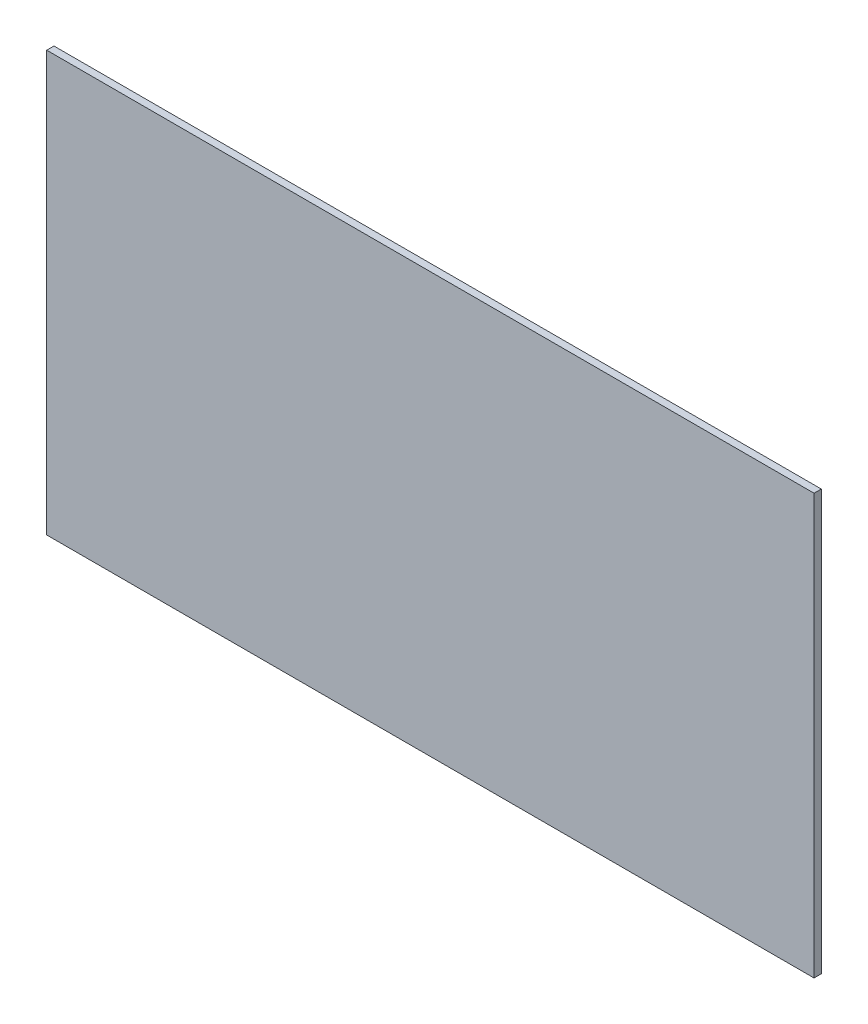
from build123d import *

# Parameters (mm, degrees)
SKETCH1_W           = 13.462
SKETCH1_H           = 7.366
BOSS_EXTRUDE1_DEPTH = 0.127
LEGEND_START        = -0.0254
LEGEND_TEXT_DEPTH   = 0.0254


# Read off the part's stored shape, not the designer's step: Legend Text
with BuildPart() as part:
    # Sketch1 → Boss-Extrude1 (new body)
    with BuildSketch(Plane.XY):
        with Locations((71.800681464, 114.580869701)):
            Rectangle(SKETCH1_W, SKETCH1_H)
    extrude(amount=BOSS_EXTRUDE1_DEPTH)

    # Legend Text outline → Legend Text (cut)
    # profile 1 of 4: a face of its own
    with BuildSketch(Plane(origin=(0, 0, 0), x_dir=(-1, 0, 0), z_dir=(0, 0, -1)).offset(LEGEND_START)):
        with BuildLine():
            add(Edge.make_bspline(
                [(-68.784550455, 113.401817513), (-68.763814965, 113.403450101), (-68.722975936, 113.406665522), (-68.663517243, 113.418947681), (-68.606934998, 113.435696163), (-68.553293855, 113.457843965), (-68.503002917, 113.48558894), (-68.455816965, 113.518656873), (-68.411625359, 113.556711828), (-68.370481107, 113.599506892), (-68.333310124, 113.64671699), (-68.301081384, 113.697939549), (-68.273322518, 113.752095701), (-68.250640785, 113.809801106), (-68.232569352, 113.870597524), (-68.219884801, 113.934686716), (-68.210955411, 114.001815856), (-68.209549437, 114.047751454), (-68.20882861, 114.071302106)],
                knots=[0, 0, 0, 0, 0.063599333, 0.125260361, 0.185380231, 0.243983491, 0.302487647, 0.360795932, 0.420007138, 0.480689722, 0.54220538, 0.603551003, 0.665616721, 0.728172033, 0.793035682, 0.859440249, 0.927936636, 1, 1, 1, 1], degree=3))
            add(Edge.make_bspline(
                [(-68.20882861, 114.071302106), (-68.209982381, 114.099943925), (-68.212271058, 114.156759238), (-68.225152599, 114.240554964), (-68.247729196, 114.321311782), (-68.277195585, 114.398543028), (-68.313716277, 114.470750694), (-68.356291135, 114.536026357), (-68.405954057, 114.592846084), (-68.443611676, 114.624575127), (-68.462284831, 114.640308499)],
                knots=[0, 0, 0, 0, 0.133571488, 0.264958941, 0.394137348, 0.523815182, 0.649747928, 0.770668013, 0.886281932, 1, 1, 1, 1], degree=3))
            add(Edge.make_bspline(
                [(-68.462284831, 114.640308499), (-68.478615254, 114.651409028), (-68.511523789, 114.673778454), (-68.567412516, 114.701653076), (-68.633538803, 114.725962581), (-68.682117713, 114.739146169), (-68.708967166, 114.746432707)],
                knots=[0, 0, 0, 0, 0.219024644, 0.441371329, 0.691247208, 1, 1, 1, 1], degree=3))
            Line((-68.708967166, 114.746432707), (-69.052546715, 114.83320272))
            add(Edge.make_bspline(
                [(-69.052546715, 114.83320272), (-69.069150991, 114.837272677), (-69.100521331, 114.844962018), (-69.142485244, 114.863475464), (-69.178024771, 114.884229678), (-69.1960652, 114.902588756), (-69.204589798, 114.911263924)],
                knots=[0, 0, 0, 0, 0.294796546, 0.556957043, 0.79065006, 1, 1, 1, 1], degree=3))
            add(Edge.make_bspline(
                [(-69.204589798, 114.911263924), (-69.214116811, 114.921748162), (-69.233521845, 114.943102911), (-69.257165162, 114.980053573), (-69.278517377, 115.020179829), (-69.296305469, 115.063675648), (-69.310159181, 115.110079818), (-69.321088516, 115.157722648), (-69.327371971, 115.206890766), (-69.328304898, 115.239968461), (-69.328777701, 115.256732091)],
                knots=[0, 0, 0, 0, 0.112997851, 0.230158927, 0.349185819, 0.475927561, 0.60480001, 0.735733993, 0.866071147, 1, 1, 1, 1], degree=3))
            add(Edge.make_bspline(
                [(-69.328777701, 115.256732091), (-69.328432982, 115.274076651), (-69.327755269, 115.308175883), (-69.319709963, 115.358327246), (-69.308779866, 115.406991053), (-69.29292426, 115.453644681), (-69.273360863, 115.497556999), (-69.250107059, 115.537847949), (-69.22367388, 115.574469246), (-69.202979376, 115.59566145), (-69.192735498, 115.606151691)],
                knots=[0, 0, 0, 0, 0.135094081, 0.26559362, 0.395124796, 0.523630082, 0.64905025, 0.769328651, 0.885816585, 1, 1, 1, 1], degree=3))
            add(Edge.make_bspline(
                [(-69.192735498, 115.606151691), (-69.179638832, 115.617191088), (-69.152892407, 115.639736092), (-69.102368665, 115.661427872), (-69.044381795, 115.674399004), (-69.002958593, 115.675912549), (-68.981051572, 115.676713)],
                knots=[0, 0, 0, 0, 0.223770634, 0.456991469, 0.712825212, 1, 1, 1, 1], degree=3))
            Line((-68.981051572, 115.676713), (-68.788550399, 115.677190391))
            add(Edge.make_bspline(
                [(-68.788550399, 115.677190391), (-68.77745857, 115.677578824), (-68.755810954, 115.678336918), (-68.723836728, 115.676572556), (-68.6936369, 115.669265171), (-68.664381283, 115.659318341), (-68.636772083, 115.644617722), (-68.611251349, 115.625432695), (-68.586524289, 115.603255416), (-68.555794325, 115.567756494), (-68.523752295, 115.515378313), (-68.49543254, 115.443923142), (-68.479989521, 115.362954067), (-68.47874074, 115.306093603), (-68.478090564, 115.276489258)],
                knots=[0, 0, 0, 0, 0.057893916, 0.112989943, 0.166318385, 0.219393398, 0.27382999, 0.328592895, 0.385562358, 0.446769483, 0.572846214, 0.703690997, 0.845727005, 1, 1, 1, 1], degree=3))
            add(Edge.make_bspline(
                [(-68.478090564, 115.276489258), (-68.477935964, 115.260849964), (-68.477645493, 115.231465895), (-68.471099417, 115.190258956), (-68.459160776, 115.155463829), (-68.443517789, 115.126071269), (-68.421916693, 115.103245609), (-68.395245053, 115.08703394), (-68.363671823, 115.078075694), (-68.341351418, 115.07677711), (-68.329629571, 115.076095141)],
                knots=[0, 0, 0, 0, 0.164761429, 0.30956393, 0.437544781, 0.551227783, 0.657873367, 0.764703299, 0.876430919, 1, 1, 1, 1], degree=3))
            add(Edge.make_bspline(
                [(-68.329629571, 115.076095141), (-68.316364397, 115.077251008), (-68.291211885, 115.079442682), (-68.256055533, 115.091078556), (-68.225910853, 115.109427703), (-68.201183516, 115.134908915), (-68.182233457, 115.167096001), (-68.169122296, 115.205719286), (-68.159814157, 115.250660487), (-68.158645061, 115.283020278), (-68.158024468, 115.300197857)],
                knots=[0, 0, 0, 0, 0.125243407, 0.237477963, 0.34582937, 0.455005964, 0.568828628, 0.695123677, 0.838162205, 1, 1, 1, 1], degree=3))
            add(Edge.make_bspline(
                [(-68.158024468, 115.300197857), (-68.158965832, 115.325623335), (-68.160798578, 115.375124324), (-68.169775705, 115.447511645), (-68.184873169, 115.515839896), (-68.203236905, 115.581126875), (-68.229335172, 115.64156938), (-68.259165149, 115.698762114), (-68.294898863, 115.751823513), (-68.335557227, 115.800980561), (-68.380343697, 115.845281769), (-68.428842795, 115.884263279), (-68.480767202, 115.916970139), (-68.536101498, 115.943704716), (-68.594580247, 115.964686361), (-68.656264136, 115.97971364), (-68.721247486, 115.989813699), (-68.765753218, 115.991060007), (-68.788560322, 115.991698682)],
                knots=[0, 0, 0, 0, 0.072749061, 0.14163551, 0.208239069, 0.272775527, 0.335243706, 0.396150844, 0.457048471, 0.517822323, 0.57832872, 0.636908998, 0.695437342, 0.753443789, 0.812342086, 0.872774246, 0.934802758, 1, 1, 1, 1], degree=3))
            Line((-68.788560322, 115.991698682), (-68.992547553, 115.988311739))
            add(Edge.make_bspline(
                [(-68.992547553, 115.988311739), (-69.016411943, 115.987035399), (-69.063114501, 115.984537605), (-69.131360135, 115.973788085), (-69.195899348, 115.9566226), (-69.257428527, 115.934490656), (-69.314421673, 115.904433932), (-69.368679163, 115.870045418), (-69.419127317, 115.82920685), (-69.465255421, 115.782084413), (-69.507319232, 115.730583543), (-69.544590471, 115.674816972), (-69.575265466, 115.614701988), (-69.60171163, 115.551066926), (-69.621882777, 115.483112274), (-69.636280166, 115.411099968), (-69.646256174, 115.335274545), (-69.647968652, 115.283295478), (-69.648843797, 115.256732091)],
                knots=[0, 0, 0, 0, 0.065201432, 0.127599052, 0.188140811, 0.247289808, 0.305632859, 0.363615379, 0.422408788, 0.482330892, 0.54329163, 0.60368726, 0.665018977, 0.727202757, 0.791546249, 0.858124041, 0.927495697, 1, 1, 1, 1], degree=3))
            add(Edge.make_bspline(
                [(-69.648843797, 115.256732091), (-69.648259824, 115.233564478), (-69.647112692, 115.188055001), (-69.639308465, 115.12116547), (-69.628528729, 115.056896843), (-69.61227737, 114.995530361), (-69.592883045, 114.936624053), (-69.568173202, 114.880606833), (-69.540331521, 114.826824957), (-69.507377305, 114.776524814), (-69.470694385, 114.729918814), (-69.431119258, 114.686395283), (-69.387430526, 114.647771074), (-69.341077854, 114.612127094), (-69.290561063, 114.58200804), (-69.237233565, 114.55524793), (-69.180607091, 114.532465855), (-69.141098752, 114.520874915), (-69.121045208, 114.514991615)],
                knots=[0, 0, 0, 0, 0.070616639, 0.138716328, 0.205110655, 0.269112602, 0.332059551, 0.393976046, 0.455559475, 0.516498315, 0.576973694, 0.636245435, 0.695556026, 0.754527205, 0.814244199, 0.874531558, 0.936315042, 1, 1, 1, 1], degree=3))
            Line((-69.121045208, 114.514991615), (-68.776550567, 114.428873743))
            add(Edge.make_bspline(
                [(-68.776550567, 114.428873743), (-68.75758613, 114.423685106), (-68.722018471, 114.413953857), (-68.674893004, 114.392231534), (-68.635557876, 114.367569777), (-68.617587027, 114.3450498), (-68.609052353, 114.334354665)],
                knots=[0, 0, 0, 0, 0.299891668, 0.56244457, 0.792197206, 1, 1, 1, 1], degree=3))
            add(Edge.make_bspline(
                [(-68.609052353, 114.334354665), (-68.596963604, 114.315688976), (-68.572698289, 114.278222006), (-68.547063204, 114.215112468), (-68.532540307, 114.146658948), (-68.530127853, 114.099406864), (-68.528894706, 114.07525354)],
                knots=[0, 0, 0, 0, 0.241778697, 0.485313731, 0.736913526, 1, 1, 1, 1], degree=3))
            add(Edge.make_bspline(
                [(-68.528894706, 114.07525354), (-68.529638875, 114.059058748), (-68.531088077, 114.02752083), (-68.536485967, 113.981554381), (-68.546042927, 113.938637829), (-68.559286326, 113.898921516), (-68.574772949, 113.861652729), (-68.594976299, 113.828007788), (-68.617165671, 113.796196778), (-68.635470347, 113.778260541), (-68.644615252, 113.769299706)],
                knots=[0, 0, 0, 0, 0.144669834, 0.281731651, 0.412517926, 0.536256951, 0.655113272, 0.771766142, 0.885975748, 1, 1, 1, 1], degree=3))
            add(Edge.make_bspline(
                [(-68.644615252, 113.769299706), (-68.654558677, 113.762318294), (-68.67641214, 113.746974685), (-68.715573869, 113.731923541), (-68.757583928, 113.719053639), (-68.786781195, 113.715639737), (-68.800979112, 113.71397964)],
                knots=[0, 0, 0, 0, 0.216441272, 0.47569036, 0.745041044, 1, 1, 1, 1], degree=3))
            Line((-68.800979112, 113.71397964), (-68.960547999, 113.710502841))
            Line((-68.960547999, 113.710502841), (-68.976547776, 113.710502841))
            add(Edge.make_bspline(
                [(-68.976547776, 113.710502841), (-68.995664634, 113.711214151), (-69.032044292, 113.712567782), (-69.083125757, 113.727558813), (-69.128249552, 113.750116325), (-69.167154718, 113.782858882), (-69.199744266, 113.825755977), (-69.227866299, 113.878365951), (-69.251359889, 113.941711602), (-69.262840163, 113.987995881), (-69.268941711, 114.012595098)],
                knots=[0, 0, 0, 0, 0.123786576, 0.23556764, 0.342676436, 0.449373233, 0.562541452, 0.690484287, 0.835498271, 1, 1, 1, 1], degree=3))
            add(Edge.make_bspline(
                [(-69.268941711, 114.012595098), (-69.270989189, 114.020692185), (-69.274659114, 114.035205513), (-69.279811992, 114.054377555), (-69.283499676, 114.068569282), (-69.28755452, 114.079992573), (-69.289130687, 114.089948032), (-69.291630751, 114.096350945), (-69.292650311, 114.098962139)],
                knots=[0, 0, 0, 0, 0.279617859, 0.501190759, 0.664744974, 0.770350089, 0.906345655, 1, 1, 1, 1], degree=3))
            add(Edge.make_bspline(
                [(-69.292650311, 114.098962139), (-69.299945582, 114.109858704), (-69.3142629, 114.131243731), (-69.346879061, 114.154260586), (-69.386544417, 114.167171567), (-69.415230847, 114.168710451), (-69.430385985, 114.169523448)],
                knots=[0, 0, 0, 0, 0.240289466, 0.471579558, 0.720833701, 1, 1, 1, 1], degree=3))
            add(Edge.make_bspline(
                [(-69.430385985, 114.169523448), (-69.442290643, 114.168381254), (-69.46493287, 114.166208843), (-69.496605959, 114.157446069), (-69.523262408, 114.142753731), (-69.545875812, 114.124144704), (-69.563123726, 114.099850773), (-69.576326876, 114.071245733), (-69.58393987, 114.037424531), (-69.585411434, 114.013384076), (-69.586185355, 114.000740798)],
                knots=[0, 0, 0, 0, 0.138666773, 0.263739154, 0.37805668, 0.489608986, 0.600539826, 0.720713111, 0.853118334, 1, 1, 1, 1], degree=3))
            add(Edge.make_bspline(
                [(-69.586185355, 114.000740798), (-69.584897436, 113.979208731), (-69.582121476, 113.932798867), (-69.564723605, 113.861518704), (-69.539599211, 113.786860398), (-69.516155164, 113.738409492), (-69.504334237, 113.71397964)],
                knots=[0, 0, 0, 0, 0.214938982, 0.463275972, 0.729373707, 1, 1, 1, 1], degree=3))
            add(Edge.make_bspline(
                [(-69.504334237, 113.71397964), (-69.490133331, 113.689262834), (-69.462179855, 113.640609551), (-69.40939261, 113.576245226), (-69.350962582, 113.51953954), (-69.286386269, 113.472509633), (-69.218324777, 113.435381706), (-69.149088961, 113.408173815), (-69.078838765, 113.392755111), (-69.03192573, 113.392019558), (-69.008711605, 113.391655582)],
                knots=[0, 0, 0, 0, 0.137457703, 0.270575754, 0.400396349, 0.529806033, 0.655052246, 0.773856294, 0.888096596, 1, 1, 1, 1], degree=3))
            Line((-69.008711605, 113.391655582), (-68.988547609, 113.391656133))
            Line((-68.988547609, 113.391656133), (-68.784550455, 113.401817513))
        make_face()
    # profile 2 of 4: a face of its own
    with BuildSketch(Plane(origin=(0, 0, 0), x_dir=(-1, 0, 0), z_dir=(0, 0, -1)).offset(LEGEND_START)):
        with BuildLine():
            Line((-70.949429837, 113.712287271), (-71.335710004, 113.712287271))
            add(Edge.make_bspline(
                [(-71.335710004, 113.712287271), (-71.351301343, 113.711721414), (-71.380660892, 113.710655867), (-71.421533838, 113.70353667), (-71.456430823, 113.69173176), (-71.485506538, 113.674983905), (-71.507503982, 113.651961796), (-71.523922598, 113.624939747), (-71.532860429, 113.592581546), (-71.534133343, 113.569710087), (-71.534806453, 113.55761578)],
                knots=[0, 0, 0, 0, 0.162897657, 0.306747336, 0.431731416, 0.546374995, 0.653433857, 0.760997037, 0.873616484, 1, 1, 1, 1], degree=3))
            add(Edge.make_bspline(
                [(-71.534806453, 113.55761578), (-71.534161724, 113.544571158), (-71.532947938, 113.520013015), (-71.523769283, 113.48552727), (-71.508552877, 113.456169742), (-71.486859134, 113.432256815), (-71.459388949, 113.413718232), (-71.425987122, 113.401033713), (-71.386899871, 113.393096879), (-71.35891668, 113.392156544), (-71.344008675, 113.391655582)],
                knots=[0, 0, 0, 0, 0.13549594, 0.255088173, 0.36798027, 0.476021954, 0.587257675, 0.709320559, 0.84514094, 1, 1, 1, 1], degree=3))
            Line((-71.344008675, 113.391655582), (-70.254223993, 113.391656133))
            add(Edge.make_bspline(
                [(-70.254223993, 113.391656133), (-70.237548869, 113.391719922), (-70.206343809, 113.391839292), (-70.162779759, 113.399435442), (-70.125751092, 113.410984879), (-70.094468665, 113.427015302), (-70.071378305, 113.450114088), (-70.054122259, 113.477301507), (-70.045300914, 113.510243771), (-70.044441193, 113.533485948), (-70.043987125, 113.54576148)],
                knots=[0, 0, 0, 0, 0.167323449, 0.313121427, 0.442287347, 0.556528349, 0.662166905, 0.766596956, 0.876726412, 1, 1, 1, 1], degree=3))
            add(Edge.make_bspline(
                [(-70.043987125, 113.54576148), (-70.044628317, 113.558809586), (-70.045835441, 113.583374288), (-70.055058758, 113.617816053), (-70.070179634, 113.647439579), (-70.092739977, 113.671061963), (-70.120355597, 113.69033596), (-70.15471871, 113.702944876), (-70.194721545, 113.710834056), (-70.2234515, 113.711781899), (-70.238736337, 113.712286168)],
                knots=[0, 0, 0, 0, 0.13367795, 0.251665576, 0.363042966, 0.47093762, 0.583363643, 0.705585, 0.843366093, 1, 1, 1, 1], degree=3))
            Line((-70.238736337, 113.712286168), (-70.6287987, 113.712287271))
            Line((-70.6287987, 113.712287271), (-70.6287987, 115.770984011))
            add(Edge.make_bspline(
                [(-70.6287987, 115.770984011), (-70.628681375, 115.783217472), (-70.628466512, 115.805621389), (-70.62978431, 115.83609425), (-70.631084206, 115.860660357), (-70.634734841, 115.884790035), (-70.641586331, 115.910508899), (-70.653820999, 115.92632947), (-70.659846227, 115.934120654)],
                knots=[0, 0, 0, 0, 0.216060692, 0.395685733, 0.538969935, 0.649917571, 0.82759431, 1, 1, 1, 1], degree=3))
            add(Edge.make_bspline(
                [(-70.659846227, 115.934120654), (-70.668373722, 115.942242115), (-70.685347214, 115.95840742), (-70.716860105, 115.975630636), (-70.752733052, 115.985919109), (-70.778129427, 115.987491702), (-70.791372506, 115.988311739)],
                knots=[0, 0, 0, 0, 0.240761183, 0.479221355, 0.728437127, 1, 1, 1, 1], degree=3))
            add(Edge.make_bspline(
                [(-70.791372506, 115.988311739), (-70.804213525, 115.988500506), (-70.828316862, 115.988854832), (-70.862194735, 115.980795315), (-70.890970706, 115.966033886), (-70.913665281, 115.94325456), (-70.931536693, 115.914393654), (-70.942808089, 115.878562184), (-70.949779522, 115.836552078), (-70.949552105, 115.806391159), (-70.949429837, 115.790175584)],
                knots=[0, 0, 0, 0, 0.1303468, 0.244668505, 0.350952396, 0.455284039, 0.568004952, 0.693428508, 0.835176339, 1, 1, 1, 1], degree=3))
            Line((-70.949429837, 115.790175584), (-70.949429837, 113.712287271))
        make_face()
    # profile 3 of 4: a face of its own
    with BuildSketch(Plane(origin=(0, 0, 0), x_dir=(-1, 0, 0), z_dir=(0, 0, -1)).offset(LEGEND_START)):
        with BuildLine():
            Line((-73.223376606, 114.577050837), (-73.227278426, 114.577050837))
            add(Edge.make_bspline(
                [(-73.227278426, 114.577050837), (-73.244951129, 114.558980541), (-73.279531537, 114.523622158), (-73.323886729, 114.465126411), (-73.36130373, 114.404294976), (-73.391370991, 114.34018118), (-73.415532085, 114.27342348), (-73.431408056, 114.203250886), (-73.441667729, 114.130317383), (-73.442033456, 114.080746592), (-73.442219748, 114.055496373)],
                knots=[0, 0, 0, 0, 0.130448083, 0.255249458, 0.378266884, 0.49869614, 0.62043218, 0.744203675, 0.86970325, 1, 1, 1, 1], degree=3))
            add(Edge.make_bspline(
                [(-73.442219748, 114.055496373), (-73.441210297, 114.032144738), (-73.439225985, 113.986241639), (-73.431043284, 113.91890935), (-73.416568598, 113.854846866), (-73.398096141, 113.793814969), (-73.374986376, 113.735858386), (-73.346648779, 113.681375353), (-73.313005857, 113.630260879), (-73.274916263, 113.582557315), (-73.232793556, 113.539206754), (-73.187518834, 113.501270329), (-73.139525304, 113.468680042), (-73.088812462, 113.441312996), (-73.034574225, 113.420682591), (-72.978017925, 113.404481331), (-72.918288037, 113.395067359), (-72.877570537, 113.392806487), (-72.856843132, 113.391655582)],
                knots=[0, 0, 0, 0, 0.071163137, 0.139887785, 0.206200628, 0.270907243, 0.333896404, 0.395916463, 0.457578168, 0.51994926, 0.581539044, 0.641330138, 0.699495776, 0.757940144, 0.816356419, 0.875858538, 0.936805293, 1, 1, 1, 1], degree=3))
            Line((-72.856843132, 113.391655582), (-72.181590702, 113.391656133))
            add(Edge.make_bspline(
                [(-72.181590702, 113.391656133), (-72.165209126, 113.392291554), (-72.134570387, 113.393479992), (-72.092624995, 113.402353248), (-72.05793387, 113.41612934), (-72.03099502, 113.436756356), (-72.011414217, 113.464502671), (-71.99898279, 113.499544216), (-71.990963464, 113.54163329), (-71.990931754, 113.572248437), (-71.990914752, 113.588662755)],
                knots=[0, 0, 0, 0, 0.153417679, 0.286939669, 0.399947666, 0.500488246, 0.600330349, 0.713654415, 0.846475742, 1, 1, 1, 1], degree=3))
            Line((-71.990914752, 113.588662755), (-71.990401529, 115.783560462))
            add(Edge.make_bspline(
                [(-71.990401529, 115.783560462), (-71.989857771, 115.801211483), (-71.988856976, 115.83369841), (-71.99491571, 115.878696872), (-72.006669465, 115.915688129), (-72.026148727, 115.944999543), (-72.054220749, 115.965603871), (-72.089768515, 115.979368779), (-72.133161739, 115.987695628), (-72.164736052, 115.988096307), (-72.181712531, 115.988311739)],
                knots=[0, 0, 0, 0, 0.158927213, 0.292507531, 0.407271171, 0.506049917, 0.604068815, 0.715862285, 0.847228411, 1, 1, 1, 1], degree=3))
            Line((-72.181712531, 115.988311739), (-72.759060042, 115.988311739))
            add(Edge.make_bspline(
                [(-72.759060042, 115.988311739), (-72.779805933, 115.987973017), (-72.820004771, 115.987316684), (-72.878081311, 115.98268693), (-72.931436923, 115.972849812), (-72.980950393, 115.959789315), (-73.028235138, 115.942503125), (-73.07452774, 115.920399039), (-73.120582836, 115.893120139), (-73.149982787, 115.871711975), (-73.165054928, 115.860736893)],
                knots=[0, 0, 0, 0, 0.143289664, 0.277649108, 0.401784546, 0.51747006, 0.630937378, 0.748935385, 0.871289538, 1, 1, 1, 1], degree=3))
            add(Edge.make_bspline(
                [(-73.165054928, 115.860736893), (-73.18573137, 115.842070409), (-73.227487642, 115.804373266), (-73.281102513, 115.736982428), (-73.328574902, 115.661919673), (-73.368514851, 115.57869588), (-73.400459671, 115.488982355), (-73.424415655, 115.393787252), (-73.438457313, 115.293268318), (-73.440948514, 115.224598968), (-73.442219748, 115.189557725)],
                knots=[0, 0, 0, 0, 0.111467294, 0.22510926, 0.34372318, 0.466818214, 0.594181077, 0.724757774, 0.859546802, 1, 1, 1, 1], degree=3))
            add(Edge.make_bspline(
                [(-73.442219748, 115.189557725), (-73.441840109, 115.16092282), (-73.441095733, 115.104776933), (-73.430461106, 115.022619522), (-73.413838988, 114.944255586), (-73.389253982, 114.869304445), (-73.356283831, 114.796517506), (-73.315242909, 114.724169607), (-73.26625637, 114.650931193), (-73.227768865, 114.604417107), (-73.207956203, 114.580472509)],
                knots=[0, 0, 0, 0, 0.128444356, 0.251847255, 0.371120416, 0.487567242, 0.605135768, 0.729169992, 0.860581679, 1, 1, 1, 1], degree=3))
            Line((-73.207956203, 114.580472509), (-73.223376606, 114.577050837))
        make_face()
        with BuildLine():
            Line((-72.310350758, 113.712287271), (-72.8292928, 113.712287271))
            add(Edge.make_bspline(
                [(-72.8292928, 113.712287271), (-72.841108669, 113.712415305), (-72.863098147, 113.712653579), (-72.894053544, 113.713862045), (-72.920418007, 113.718021148), (-72.950290477, 113.72438696), (-72.984178189, 113.739619173), (-73.005596245, 113.759229991), (-73.016593934, 113.769299706)],
                knots=[0, 0, 0, 0, 0.175434205, 0.326485192, 0.459200983, 0.570988135, 0.779712054, 1, 1, 1, 1], degree=3))
            add(Edge.make_bspline(
                [(-73.016593934, 113.769299706), (-73.032520335, 113.788276543), (-73.064515426, 113.826399762), (-73.097270634, 113.895656498), (-73.117130661, 113.972930017), (-73.120440426, 114.0273349), (-73.122153652, 114.055496373)],
                knots=[0, 0, 0, 0, 0.237392928, 0.476906795, 0.729232475, 1, 1, 1, 1], degree=3))
            add(Edge.make_bspline(
                [(-73.122153652, 114.055496373), (-73.120892298, 114.083474907), (-73.118464805, 114.137319985), (-73.098835443, 114.213500433), (-73.06725825, 114.281825702), (-73.036095874, 114.31950403), (-73.020545368, 114.338306098)],
                knots=[0, 0, 0, 0, 0.272613178, 0.524647865, 0.76279194, 1, 1, 1, 1], degree=3))
            add(Edge.make_bspline(
                [(-73.020545368, 114.338306098), (-73.009604565, 114.349335015), (-72.988476281, 114.37063346), (-72.954405038, 114.387822753), (-72.924494158, 114.396054431), (-72.897991769, 114.400288539), (-72.867259262, 114.403264543), (-72.845373857, 114.403237127), (-72.833699023, 114.403222502)],
                knots=[0, 0, 0, 0, 0.226233756, 0.436890346, 0.548504896, 0.679825828, 0.829202146, 1, 1, 1, 1], degree=3))
            Line((-72.833699023, 114.403222502), (-72.310350758, 114.403222502))
            Line((-72.310350758, 114.403222502), (-72.310350758, 113.712287271))
        make_face(mode=Mode.SUBTRACT)
        with BuildLine():
            Line((-72.290841659, 114.72385364), (-72.762961862, 114.72385364))
            add(Edge.make_bspline(
                [(-72.762961862, 114.72385364), (-72.782070501, 114.723987473), (-72.81692479, 114.724231587), (-72.865833608, 114.733357512), (-72.909242084, 114.750994891), (-72.933799843, 114.769519704), (-72.946597116, 114.779173154)],
                knots=[0, 0, 0, 0, 0.291508259, 0.531713047, 0.75597136, 1, 1, 1, 1], degree=3))
            add(Edge.make_bspline(
                [(-72.946597116, 114.779173154), (-72.959537938, 114.790698193), (-72.985775017, 114.814064821), (-73.019577397, 114.85597731), (-73.049537261, 114.903168069), (-73.075625543, 114.955400956), (-73.095283567, 115.01230859), (-73.111004881, 115.071831483), (-73.119937488, 115.133971318), (-73.121410549, 115.176171978), (-73.122153652, 115.197460592)],
                knots=[0, 0, 0, 0, 0.110984547, 0.225017424, 0.343859372, 0.469068413, 0.598464438, 0.729298708, 0.863441586, 1, 1, 1, 1], degree=3))
            add(Edge.make_bspline(
                [(-73.122153652, 115.197460592), (-73.121710152, 115.215545312), (-73.120838973, 115.251069533), (-73.114276019, 115.303104321), (-73.104951148, 115.353018664), (-73.091330965, 115.400632098), (-73.073807696, 115.446005034), (-73.052247819, 115.489085267), (-73.026857022, 115.529881424), (-73.007223474, 115.555133369), (-72.997401259, 115.56776634)],
                knots=[0, 0, 0, 0, 0.136018339, 0.267183868, 0.39406249, 0.517733739, 0.639189461, 0.759476315, 0.879671503, 1, 1, 1, 1], degree=3))
            add(Edge.make_bspline(
                [(-72.997401259, 115.56776634), (-72.989923437, 115.576649046), (-72.975390355, 115.593912511), (-72.950078515, 115.615507558), (-72.923378997, 115.633188551), (-72.894305039, 115.647427039), (-72.861379779, 115.656646302), (-72.824162944, 115.663436599), (-72.781843961, 115.667232501), (-72.751855066, 115.667526257), (-72.736042171, 115.667681153)],
                knots=[0, 0, 0, 0, 0.119313871, 0.231885509, 0.340904025, 0.448294015, 0.563466716, 0.691452478, 0.837305457, 1, 1, 1, 1], degree=3))
            Line((-72.736042171, 115.667681153), (-72.290841659, 115.667681153))
            Line((-72.290841659, 115.667681153), (-72.290841659, 114.72385364))
        make_face(mode=Mode.SUBTRACT)
    # profile 4 of 4: a face of its own
    with BuildSketch(Plane(origin=(0, 0, 0), x_dir=(-1, 0, 0), z_dir=(0, 0, -1)).offset(LEGEND_START)):
        with BuildLine():
            Line((-74.582489944, 114.503018243), (-74.157191579, 113.502854692))
            add(Edge.make_bspline(
                [(-74.157191579, 113.502854692), (-74.153273617, 113.493454442), (-74.145790054, 113.475499351), (-74.129790464, 113.452495431), (-74.113966184, 113.431911896), (-74.094455055, 113.416860223), (-74.074325655, 113.403642736), (-74.051328447, 113.396320023), (-74.027073097, 113.391229107), (-74.010315775, 113.39150999), (-74.001629803, 113.391655582)],
                knots=[0, 0, 0, 0, 0.148007734, 0.282704437, 0.407417976, 0.524407071, 0.640167052, 0.756446138, 0.873756545, 1, 1, 1, 1], degree=3))
            add(Edge.make_bspline(
                [(-74.001629803, 113.391655582), (-73.990493976, 113.392463901), (-73.968883101, 113.394032574), (-73.937761465, 113.401645101), (-73.910262275, 113.41597912), (-73.885396791, 113.433576083), (-73.864883473, 113.455896232), (-73.849238178, 113.481458874), (-73.840066885, 113.510753712), (-73.838285809, 113.531211405), (-73.837363076, 113.541810047)],
                knots=[0, 0, 0, 0, 0.135506683, 0.262972674, 0.385595346, 0.509909445, 0.631183515, 0.751093818, 0.871047653, 1, 1, 1, 1], degree=3))
            add(Edge.make_bspline(
                [(-73.837363076, 113.541810047), (-73.837911968, 113.549927426), (-73.839099154, 113.567484304), (-73.84572225, 113.595613169), (-73.857326964, 113.626936314), (-73.867139964, 113.648747343), (-73.872361485, 113.660353045)],
                knots=[0, 0, 0, 0, 0.195859132, 0.423618867, 0.693306192, 1, 1, 1, 1], degree=3))
            Line((-73.872361485, 113.660353045), (-73.880162369, 113.67611137))
            Line((-73.880162369, 113.67611137), (-74.42251533, 114.951910546))
            Line((-74.42251533, 114.951910546), (-74.42251533, 115.806380981))
            add(Edge.make_bspline(
                [(-74.42251533, 115.806380981), (-74.422922412, 115.820780553), (-74.423693059, 115.848040396), (-74.431204502, 115.886071673), (-74.44227865, 115.919089586), (-74.460578547, 115.945478735), (-74.483832044, 115.965876393), (-74.512316924, 115.980217982), (-74.545936895, 115.988140678), (-74.569840624, 115.988252541), (-74.582490495, 115.988311739)],
                knots=[0, 0, 0, 0, 0.154396486, 0.292288132, 0.415018318, 0.525421887, 0.632807831, 0.743948415, 0.864497304, 1, 1, 1, 1], degree=3))
            add(Edge.make_bspline(
                [(-74.582490495, 115.988311739), (-74.594024756, 115.987993456), (-74.616816808, 115.987364518), (-74.649463671, 115.97893136), (-74.680529401, 115.966681188), (-74.698612563, 115.954077216), (-74.707807379, 115.947668425)],
                knots=[0, 0, 0, 0, 0.257345281, 0.508522159, 0.750096344, 1, 1, 1, 1], degree=3))
            add(Edge.make_bspline(
                [(-74.707807379, 115.947668425), (-74.713989375, 115.941239077), (-74.72735105, 115.927342778), (-74.735174326, 115.902235093), (-74.739400425, 115.87781258), (-74.741289167, 115.853226791), (-74.743297682, 115.823512839), (-74.742978008, 115.801847446), (-74.742805788, 115.790175584)],
                knots=[0, 0, 0, 0, 0.159348626, 0.344413794, 0.461814385, 0.608663581, 0.789174157, 1, 1, 1, 1], degree=3))
            Line((-74.742805788, 115.790175584), (-74.742464558, 114.947972894))
            Line((-74.742464558, 114.947972894), (-75.27311206, 113.687924325))
            Line((-75.27311206, 113.687924325), (-75.280915699, 113.664298414))
            add(Edge.make_bspline(
                [(-75.280915699, 113.664298414), (-75.285299488, 113.654938091), (-75.2932264, 113.638012444), (-75.302442467, 113.614755341), (-75.310098914, 113.597271511), (-75.316370471, 113.580553102), (-75.320739293, 113.561238826), (-75.320439169, 113.545976431), (-75.320279538, 113.537858613)],
                knots=[0, 0, 0, 0, 0.231524356, 0.418650011, 0.560372718, 0.659066661, 0.818663143, 1, 1, 1, 1], degree=3))
            add(Edge.make_bspline(
                [(-75.320279538, 113.537858613), (-75.319582663, 113.527441632), (-75.318224542, 113.507140263), (-75.308965407, 113.478358082), (-75.293944548, 113.453045466), (-75.273883726, 113.43141058), (-75.249572013, 113.413769649), (-75.221380115, 113.401543705), (-75.190172371, 113.393114787), (-75.168116224, 113.392156776), (-75.156577302, 113.391655582)],
                knots=[0, 0, 0, 0, 0.127390285, 0.248267446, 0.36594435, 0.484898317, 0.606953944, 0.730627701, 0.859074842, 1, 1, 1, 1], degree=3))
            add(Edge.make_bspline(
                [(-75.156577302, 113.391655582), (-75.140382, 113.392073238), (-75.10906695, 113.392880813), (-75.065813976, 113.412243107), (-75.030311482, 113.44533347), (-75.015838905, 113.47474654), (-75.008116309, 113.490441414)],
                knots=[0, 0, 0, 0, 0.252573238, 0.488372686, 0.726994634, 1, 1, 1, 1], degree=3))
            Line((-75.008116309, 113.490441414), (-74.582489944, 114.503018243))
        make_face()
    extrude(amount=LEGEND_TEXT_DEPTH, mode=Mode.SUBTRACT)


solid = part.part
